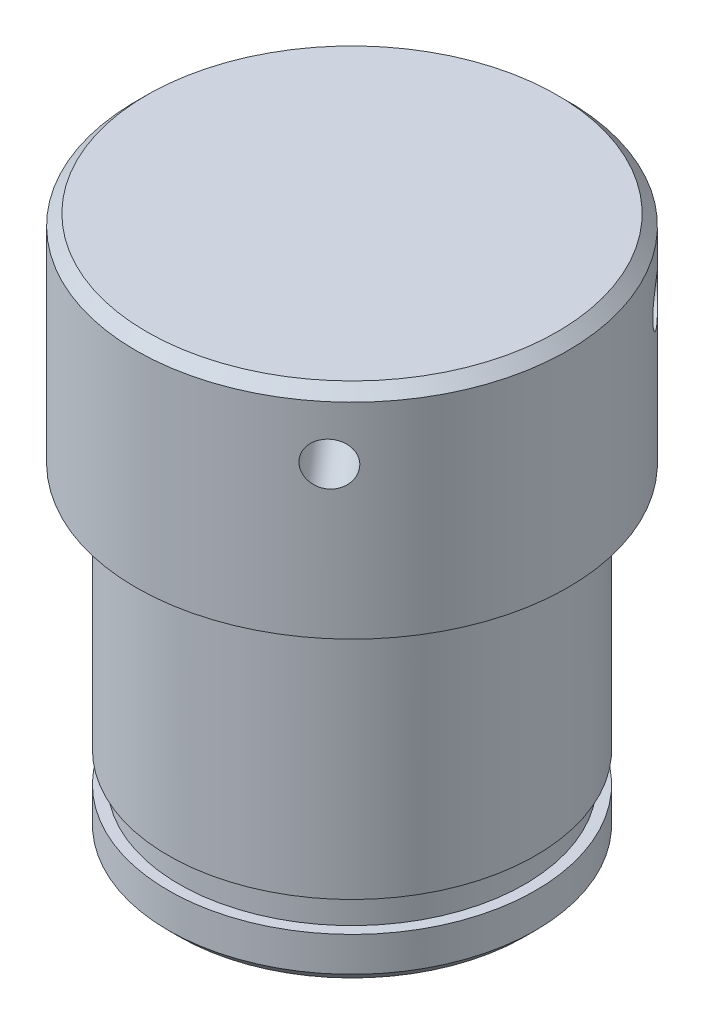
from build123d import *

# Parameters (mm, degrees)
SKETCH_1_R               = 8.5
EXTRUDE_1_DEPTH          = 15
SKETCH_2_R               = 10
EXTRUDE_2_DEPTH          = 10
SKETCH_3_R               = 1
CUT_EXTRUDE_1_DEPTH      = 10
CUT_EXTRUDE_START        = -2.1
SKETCH_4_R               = 8.5
SKETCH_4_R_2             = 8
CUT_EXTRUDE_2_DEPTH      = 1.4
CHAMFER_1_SIZE           = 0.5
SKETCH_7_R               = 1
CUT_EXTRUDE_3_DEPTH      = 8
PATTERN_CIRCULAR_1_COUNT = 4
SKETCH_8_R               = 3.5
CUT_EXTRUDE_4_DEPTH      = 5.5
CHAMFER_2_SIZE           = 0.5


with BuildPart() as part:
    # Эскиз1 → Бобышка-Вытянуть1 (new body)
    with BuildSketch(Plane(origin=(0, 0, 0), x_dir=(1, 0, 0), z_dir=(0, 1, 0))):
        Circle(SKETCH_1_R)
    extrude(amount=EXTRUDE_1_DEPTH)

    # Эскиз2 → Бобышка-Вытянуть2 (add)
    with BuildSketch(Plane(origin=(0, 15, 0), x_dir=(1, 0, 0), z_dir=(0, 1, 0))):
        Circle(SKETCH_2_R)
    extrude(amount=EXTRUDE_2_DEPTH)

    # Эскиз3 → Вырез-Вытянуть1 (cut)
    with BuildSketch(Plane.XZ):
        with Locations((0, 6)):
            Circle(SKETCH_3_R)
        with Locations((6, 0)):
            Circle(SKETCH_3_R)
        with Locations((0, -6)):
            Circle(SKETCH_3_R)
        with Locations((-6, 0)):
            Circle(SKETCH_3_R)
    extrude(amount=-CUT_EXTRUDE_1_DEPTH, mode=Mode.SUBTRACT)

    # Эскиз4 → Вырез-Вытянуть2 (cut)
    with BuildSketch(Plane.XZ.offset(CUT_EXTRUDE_START)):
        Circle(SKETCH_4_R)
        Circle(SKETCH_4_R_2, mode=Mode.SUBTRACT)
    extrude(amount=-CUT_EXTRUDE_2_DEPTH, mode=Mode.SUBTRACT)

    # Фаска1
    chamfer_1_edges = [part.edges().sort_by_distance(p)[0] for p in [
        (-8.5, 0, 0),
        (-10, 25, 0),
    ]]
    chamfer(chamfer_1_edges, length=CHAMFER_1_SIZE)

    # Эскиз7 → Вырез-Вытянуть3 (cut)
    with BuildSketch(Plane(origin=(6.524591557, 0, 7.578238913), x_dir=(0.7578238912515232, 0, -0.6524591556935956), z_dir=(0.6524591556935956, 0, 0.7578238912515232))):
        with Locations((0, 22)):
            Circle(SKETCH_7_R)
    cut_extrude_3 = extrude(amount=-CUT_EXTRUDE_3_DEPTH, mode=Mode.SUBTRACT)

    # Круговой массив1: Вырез-Вытянуть3 ×4 about axis
    pattern_circular_1_axis = Axis((0, 25, 0), (0, -1, 0))
    for i in range(1, PATTERN_CIRCULAR_1_COUNT):
        add(cut_extrude_3.rotate(pattern_circular_1_axis, i * 360 / PATTERN_CIRCULAR_1_COUNT), mode=Mode.SUBTRACT)

    # Эскиз8 → Вырез-Вытянуть4 (cut)
    with BuildSketch(Plane.XZ):
        Circle(SKETCH_8_R)
    extrude(amount=-CUT_EXTRUDE_4_DEPTH, mode=Mode.SUBTRACT)

    # Фаска2
    chamfer_2_edges = [part.edges().sort_by_distance(p)[0] for p in [
        (-3.5, 0, 0),
    ]]
    chamfer(chamfer_2_edges, length=CHAMFER_2_SIZE)


solid = part.part
